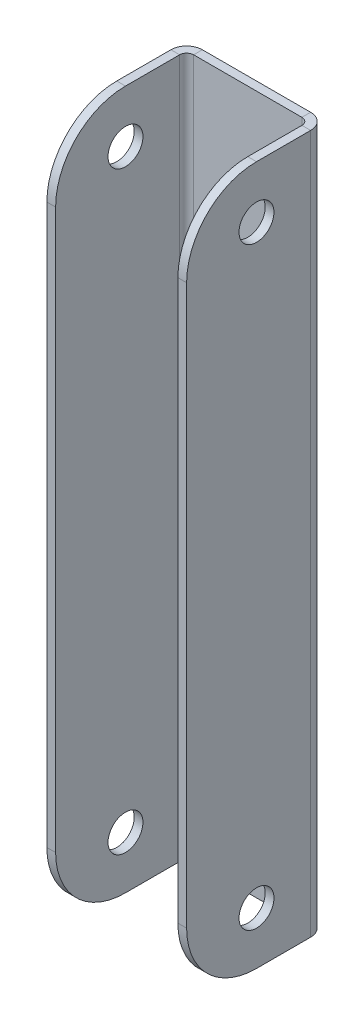
from build123d import *

# Parameters (mm, degrees)
BASE_FLANGE1_DEPTH = 100
CUT_EXTRUDE1_REACH = 104.47
SKETCH3_R          = 2.5
FILLET1_R          = 10


# Sheet-metal steps are written as plain solids
with BuildPart() as part:
    # Sketch2 → Base-Flange1 (new body)
    with BuildSketch(Plane(origin=(0, 0, 0), x_dir=(1, 0, 0), z_dir=(0, 1, 0))):
        with BuildLine():
            Line((-10, -10), (-10, 7.75))
            ThreePointArc((-10, 7.75), (-9.340990258, 9.340990258), (-7.75, 10))
            Line((-7.75, 10), (7.75, 10))
            ThreePointArc((7.75, 10), (9.340990258, 9.340990258), (10, 7.75))
            Line((10, 7.75), (10, -10))
            Line((10, -10), (8.75, -10))
            Line((8.75, -10), (8.75, 7.75))
            ThreePointArc((8.75, 7.75), (8.457106781, 8.457106781), (7.75, 8.75))
            Line((7.75, 8.75), (-7.75, 8.75))
            ThreePointArc((-7.75, 8.75), (-8.457106781, 8.457106781), (-8.75, 7.75))
            Line((-8.75, 7.75), (-8.75, -10))
            Line((-8.75, -10), (-10, -10))
        make_face()
    extrude(amount=BASE_FLANGE1_DEPTH)

    # Cut-Extrude1: up to this face of the body (flat: up to its plane)
    cut_extrude1_end = Plane(part.part.faces().sort_by_distance((10, 50, 1.125))[0])
    # Sketch3 → Cut-Extrude1 (cut, up to the picked face)
    with BuildSketch(Plane.ZY.offset(10), mode=Mode.PRIVATE) as cut_extrude1_sk1:
        with Locations((0, 7.5)):
            Circle(SKETCH3_R)
    cut_extrude1_tool1 = split(extrude(cut_extrude1_sk1.sketch, amount=-CUT_EXTRUDE1_REACH, mode=Mode.PRIVATE), bisect_by=cut_extrude1_end, keep=Keep.BOTH, mode=Mode.PRIVATE)
    # Sketch3 → Cut-Extrude1 (cut, up to the picked face)
    with BuildSketch(Plane.ZY.offset(10), mode=Mode.PRIVATE) as cut_extrude1_sk2:
        with Locations((0, 92.5)):
            Circle(SKETCH3_R)
    cut_extrude1_tool2 = split(extrude(cut_extrude1_sk2.sketch, amount=-CUT_EXTRUDE1_REACH, mode=Mode.PRIVATE), bisect_by=cut_extrude1_end, keep=Keep.BOTH, mode=Mode.PRIVATE)
    add(cut_extrude1_tool1.solids().sort_by(Axis((-10, 7.5, 0), (1, 0, 0)))[0], mode=Mode.SUBTRACT)
    add(cut_extrude1_tool2.solids().sort_by(Axis((-10, 92.5, 0), (1, 0, 0)))[0], mode=Mode.SUBTRACT)

    # Fillet1
    fillet1_edges = [part.edges().sort_by_distance(p)[0] for p in [
        (-9.375, 0, 10),
        (9.375, 0, 10),
        (-9.375, 100, 10),
        (9.375, 100, 10),
    ]]
    fillet(fillet1_edges, radius=FILLET1_R)


solid = part.part
